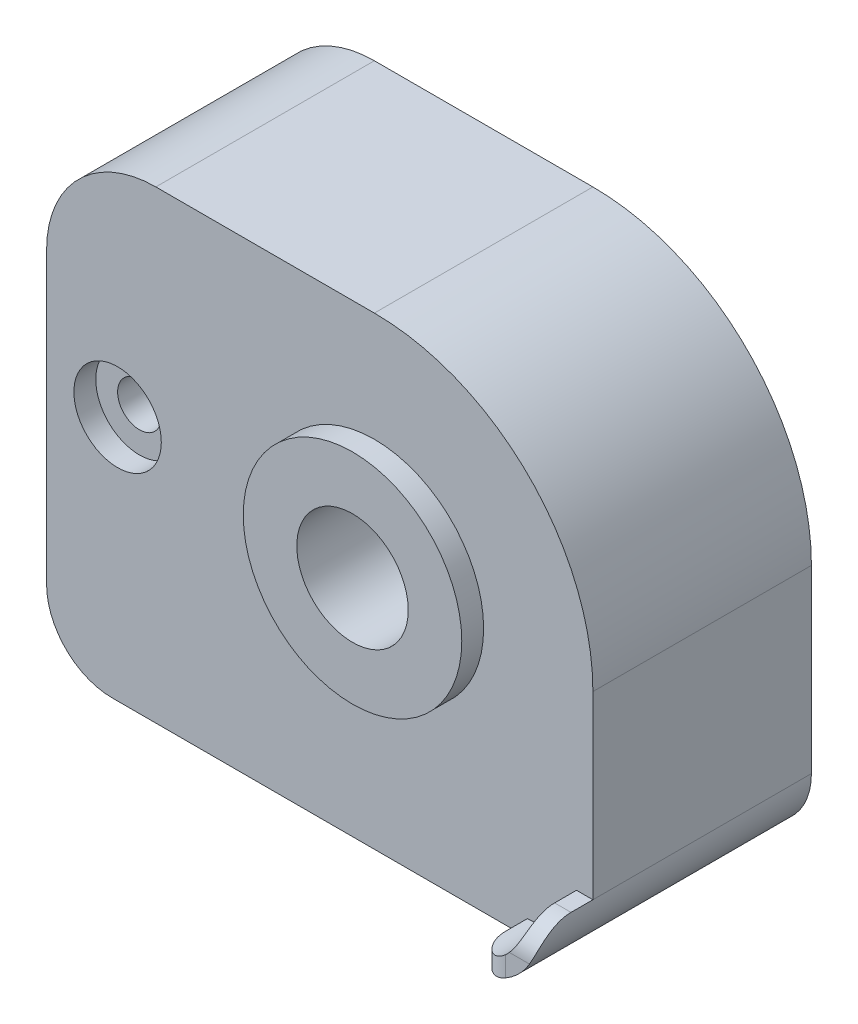
from build123d import *

# Parameters (mm, degrees)
BOSS_EXTRU_1_DEPTH           = 20
ESQUISSE3_R                  = 5
ENL_V_MAT_EXTRU_1_DEPTH      = 20
CONG_1_R                     = 10
ENL_V_MAT_EXTRU_3_DEPTH      = 42.231056256
ENL_V_MAT_EXTRU_3_DEPTH_BACK = 42.231056256
ESQUISSE1_4_R                = 2
ESQUISSE1_5_R                = 4
ENL_V_MAT_EXTRU_4_DEPTH      = 2
ENL_V_START                  = 18
ESQUISSE1_6_R                = 4
ENL_V_MAT_EXTRU_5_DEPTH      = 2
BOSS_EXTRU_4_DEPTH           = 20
BOSS_EXTRU_5_START           = 5
BOSS_EXTRU_5_DEPTH           = 5
CONG_3_START                 = -24
CONG_3_DEPTH                 = 7.5
CONG_4_START                 = 16.9999999
CONG_4_DEPTH                 = 4.0000001
ENL_V_MAT_EXTRU_6_DEPTH      = 2
ENL_V_MAT_EXTRU_6_DEPTH_BACK = 43.500000171
ESQUISSE7_R                  = 5.1
BOSS_EXTRU_7_START           = 2
ESQUISSE9_R                  = 10
ESQUISSE9_R_2                = 5.1
BOSS_EXTRU_7_DEPTH           = 2


with BuildPart() as part:
    # Esquisse1 → Boss.-Extru.1 (new body)
    with BuildSketch(Plane.XY):
        with BuildLine():
            Line((0, 20), (-30, 20))
            Line((-30, 20), (-30, -20))
            Line((-30, -20), (0, -20))
            ThreePointArc((0, -20), (20, 0), (0, 20))
        make_face()
    extrude(amount=BOSS_EXTRU_1_DEPTH)

    # Esquisse3 → Enlèv. mat.-Extru.1 (cut)
    with BuildSketch(Plane.ZY.offset(30)):
        with Locations(Location((10, 0, 0), (0, 0, 270))):
            Circle(ESQUISSE3_R)
    extrude(amount=-ENL_V_MAT_EXTRU_1_DEPTH, mode=Mode.SUBTRACT)

    # Congé1
    cong_1_edges = [part.edges().sort_by_distance(p)[0] for p in [
        (-30, 20, 10),
        (-30, -20, 10),
    ]]
    fillet(cong_1_edges, radius=CONG_1_R)

    # Esquisse1<4> → Enlèv. mat.-Extru.3 (cut, two sides: drawn at the far end of the back side and taken through both)
    with BuildSketch(Plane.XY.offset(-ENL_V_MAT_EXTRU_3_DEPTH_BACK)):
        with Locations((-23.5, 0)):
            Circle(ESQUISSE1_4_R)
    extrude(amount=ENL_V_MAT_EXTRU_3_DEPTH + ENL_V_MAT_EXTRU_3_DEPTH_BACK, mode=Mode.SUBTRACT)

    # Esquisse1<5> → Enlèv. mat.-Extru.4 (cut)
    with BuildSketch(Plane.XY):
        with Locations((-23.5, 0)):
            Circle(ESQUISSE1_5_R)
    extrude(amount=ENL_V_MAT_EXTRU_4_DEPTH, mode=Mode.SUBTRACT)

    # Esquisse1<6> → Enlèv. mat.-Extru.5 (cut)
    with BuildSketch(Plane.XY.offset(ENL_V_START)):
        with Locations((-23.5, 0)):
            Circle(ESQUISSE1_6_R)
    extrude(amount=ENL_V_MAT_EXTRU_5_DEPTH, mode=Mode.SUBTRACT)

    # Esquisse5 → Boss.-Extru.4 (add)
    with BuildSketch(Plane.XY.offset(20)):
        with BuildLine():
            Line((20, 0), (20, -16.5))
            ThreePointArc((20, -16.5), (18.242640687, -20.742640687), (14, -22.5))
            Line((14, -22.5), (-24, -22.5))
            ThreePointArc((-24, -22.5), (-28.242640687, -20.742640687), (-30, -16.5))
            Line((-30, -16.5), (-30, -10))
            ThreePointArc((-30, -10), (-27.071067812, -17.071067812), (-20, -20))
            Line((-20, -20), (0, -20))
            ThreePointArc((0, -20), (14.142135624, -14.142135624), (20, 0))
        make_face()
    extrude(amount=-BOSS_EXTRU_4_DEPTH)

    # Esquisse6 → Boss.-Extru.5 (add)
    with BuildSketch(Plane.XY.offset(20).offset(BOSS_EXTRU_5_START)):
        with BuildLine():
            Line((20, -16.5), (18.5, -16.5))
            ThreePointArc((18.5, -16.5), (17.181980515, -19.681980515), (14, -21))
            Line((14, -21), (14, -22.5))
            ThreePointArc((14, -22.5), (18.242640687, -20.742640687), (20, -16.5))
        make_face()
    extrude(amount=-BOSS_EXTRU_5_DEPTH)

    # Congé3: read off the stored shape, not the designer's step
    # Congé3 outline → Congé3 (cut)
    with BuildSketch(Plane(origin=(0, 0, 0), x_dir=(1, 0, 0), z_dir=(0, 1, 0)).offset(CONG_3_START)):
        with BuildLine():
            Line((14, -25), (17, -25))
            add(Edge.make_bspline(
                [(17, -25), (14, -25), (14, -22)],
                knots=[0, 0, 0, 1, 1, 1], degree=2, weights=[1, 0.707106781, 1]))
            Line((14, -22), (14, -25))
        make_face()
    extrude(amount=CONG_3_DEPTH, mode=Mode.SUBTRACT)

    # Congé4: read off the stored shape, not the designer's step
    # Congé4 outline → Congé4 (cut)
    with BuildSketch(Plane.YZ.offset(CONG_4_START)):
        with BuildLine():
            Line((-16.5, 25), (-19.5, 25))
            add(Edge.make_bspline(
                [(-19.5, 25), (-16.5, 25), (-16.5, 22)],
                knots=[0, 0, 0, 1, 1, 1], degree=2, weights=[1, 0.707106781, 1]))
            Line((-16.5, 22), (-16.5, 25))
        make_face()
    extrude(amount=CONG_4_DEPTH, mode=Mode.SUBTRACT)

    # Esquisse7 → Enlèv. mat.-Extru.6 (cut, two sides: drawn at the far end of the back side and taken through both)
    with BuildSketch(Plane.XY.offset(20).offset(-ENL_V_MAT_EXTRU_6_DEPTH_BACK)):
        Circle(ESQUISSE7_R)
    extrude(amount=ENL_V_MAT_EXTRU_6_DEPTH + ENL_V_MAT_EXTRU_6_DEPTH_BACK, mode=Mode.SUBTRACT)

    # Esquisse9 → Boss.-Extru.7 (add)
    with BuildSketch(Plane.XY.offset(20).offset(BOSS_EXTRU_7_START)):
        Circle(ESQUISSE9_R)
        Circle(ESQUISSE9_R_2, mode=Mode.SUBTRACT)
    extrude(amount=-BOSS_EXTRU_7_DEPTH)


solid = part.part
